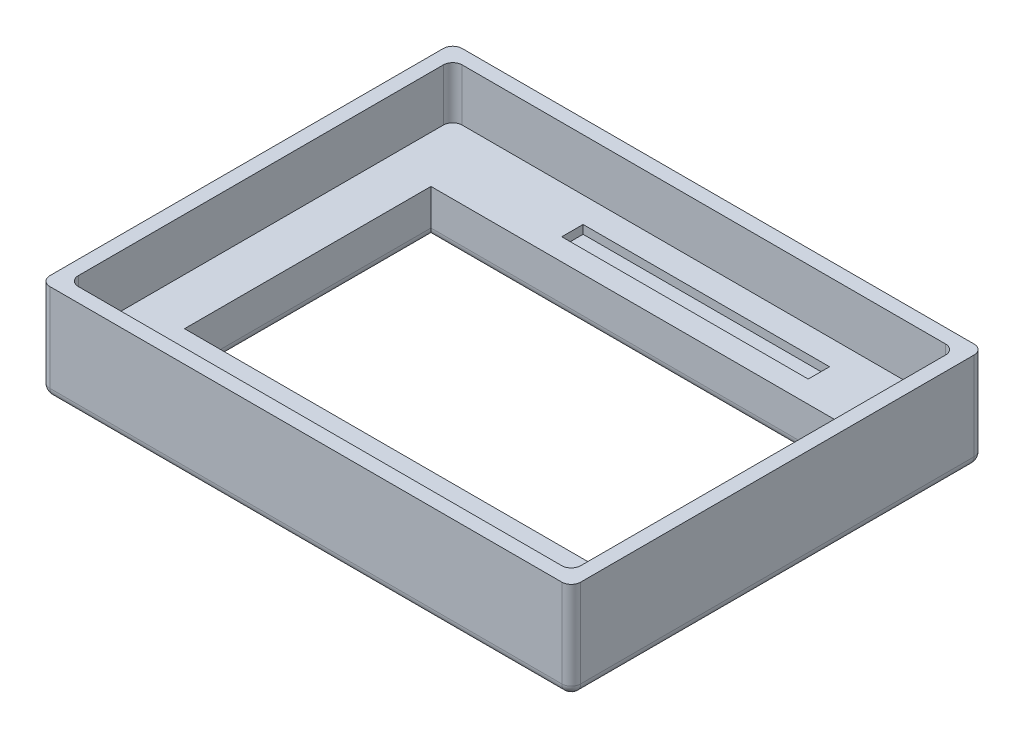
from build123d import *

# Parameters (mm, degrees)
SKETCH2_W                = 106
SKETCH2_H                = 81
BOSS_EXTRUDE1_DEPTH      = 9.6
SKETCH5_W                = 86.1
SKETCH5_H                = 52
CUT_EXTRUDE1_DEPTH       = 82.931988497
SKETCH6_W                = 52
SKETCH6_H                = 4.5
CUT_EXTRUDE2_DEPTH       = 1.8
BOSS_EXTRUDE2_DEPTH      = 11
BOSS_EXTRUDE2_DEPTH_BACK = 9.6
SKETCH7_W                = 3
SKETCH7_H                = 81
SKETCH8_W                = 112
SKETCH8_H                = 3
BOSS_EXTRUDE3_DEPTH      = 20.6
FILLET1_R                = 2
FILLET2_R                = 2


with BuildPart() as part:
    # Sketch2 → Boss-Extrude1 (new body)
    with BuildSketch(Plane(origin=(0, 0, 0), x_dir=(1, 0, 0), z_dir=(0, 1, 0))):
        with Locations((5.781721187, -15.761887574)):
            Rectangle(SKETCH2_W, SKETCH2_H)
    extrude(amount=BOSS_EXTRUDE1_DEPTH)

    # Sketch5 → Cut-Extrude1 (cut, through all)
    with BuildSketch(Plane(origin=(0, 9.6, 0), x_dir=(1, 0, 0), z_dir=(0, 1, 0))):
        with Locations((5.731721187, -15.761887574)):
            Rectangle(SKETCH5_W, SKETCH5_H)
    extrude(amount=-CUT_EXTRUDE1_DEPTH, mode=Mode.SUBTRACT)

    # Sketch6 → Cut-Extrude2 (cut)
    with BuildSketch(Plane(origin=(0, 9.6, 0), x_dir=(1, 0, 0), z_dir=(0, 1, 0))):
        with Locations((11.681721187, 17.088112426)):
            Rectangle(SKETCH6_W, SKETCH6_H)
    extrude(amount=-CUT_EXTRUDE2_DEPTH, mode=Mode.SUBTRACT)

    # Sketch7 → Boss-Extrude2 (add, two sides: drawn at the far end of the back side and taken through both)
    with BuildSketch(Plane(origin=(0, 9.6, 0), x_dir=(1, 0, 0), z_dir=(0, 1, 0)).offset(-BOSS_EXTRUDE2_DEPTH_BACK)):
        with Locations((-48.718278813, -15.761887574)):
            Rectangle(SKETCH7_W, SKETCH7_H)
        with Locations((60.281721187, -15.761887574)):
            Rectangle(SKETCH7_W, SKETCH7_H)
    extrude(amount=BOSS_EXTRUDE2_DEPTH + BOSS_EXTRUDE2_DEPTH_BACK)

    # Sketch8 → Boss-Extrude3 (add)
    with BuildSketch(Plane(origin=(0, 0, 0), x_dir=(-1, 0, 0), z_dir=(0, -1, 0))):
        with Locations((-5.781721187, 26.238112426)):
            Rectangle(SKETCH8_W, SKETCH8_H)
        with Locations((-5.781721187, -57.761887574)):
            Rectangle(SKETCH8_W, SKETCH8_H)
    extrude(amount=-BOSS_EXTRUDE3_DEPTH)

    # Fillet1
    fillet1_edges = [part.edges().sort_by_distance(p)[0] for p in [
        (5.781721187, 0, -27.738112426),
        (-50.218278813, 0, 15.761887574),
        (5.781721187, 0, 59.261887574),
        (61.781721187, 0, 15.761887574),
        (48.781721187, 0, 15.761887574),
        (5.731721187, 0, 41.761887574),
        (-37.318278813, 0, 15.761887574),
        (5.731721187, 0, -10.238112426),
        (61.781721187, 10.3, 59.261887574),
        (61.781721187, 10.3, -27.738112426),
        (-50.218278813, 10.3, -27.738112426),
        (-50.218278813, 10.3, 59.261887574),
    ]]
    fillet(fillet1_edges, radius=FILLET1_R)

    # Fillet2
    fillet2_edges = [part.edges().sort_by_distance(p)[0] for p in [
        (-47.218278813, 15.1, -24.738112426),
        (58.781721187, 15.1, -24.738112426),
        (58.781721187, 15.1, 56.261887574),
        (-47.218278813, 15.1, 56.261887574),
    ]]
    fillet(fillet2_edges, radius=FILLET2_R)


solid = part.part
